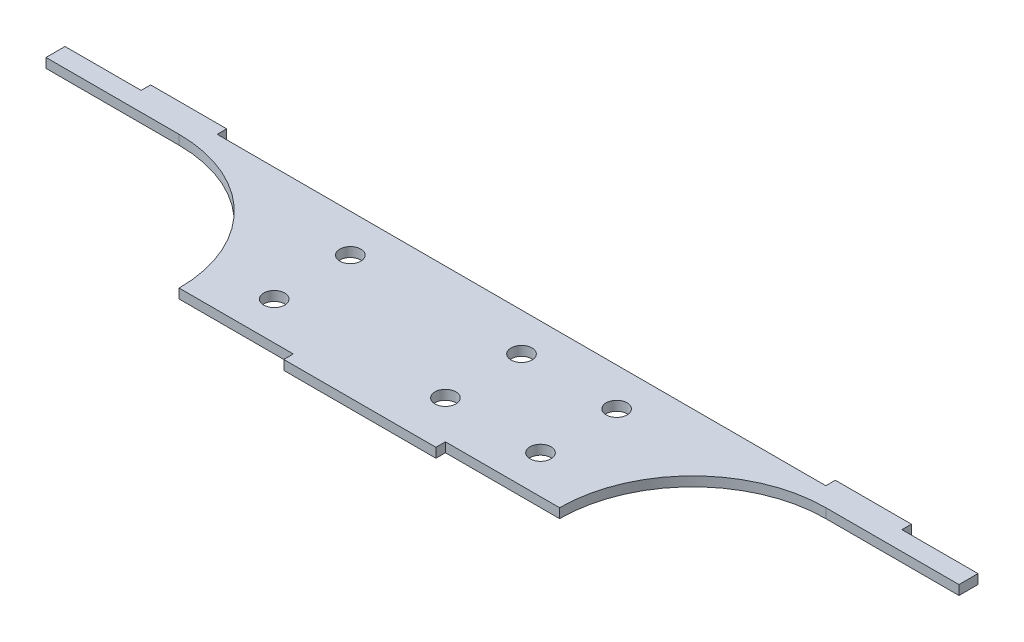
from build123d import *

# Parameters (mm, degrees)
SKETCH1_R           = 3.5
BOSS_EXTRUDE1_DEPTH = 3.175


with BuildPart() as part:
    # Sketch1 → Boss-Extrude1 (new body)
    with BuildSketch(Plane(origin=(0, 0, 0), x_dir=(1, 0, 0), z_dir=(0, 1, 0))):
        with BuildLine():
            Line((-152.4, 19.05), (-107.95, 19.05))
            ThreePointArc((-107.95, 19.05), (-76.519103576, 6.030896424), (-63.5, -25.4))
            Line((-63.5, -25.4), (-25.4, -25.4))
            Line((-25.4, -25.4), (-25.4, -28.575))
            Line((-25.4, -28.575), (25.4, -28.575))
            Line((25.4, -28.575), (25.4, -25.4))
            Line((25.4, -25.4), (63.5, -25.4))
            ThreePointArc((63.5, -25.4), (76.519103576, 6.030896424), (107.95, 19.05))
            Line((107.95, 19.05), (152.4, 19.05))
            Line((152.4, 19.05), (152.4, 25.4))
            Line((152.4, 25.4), (127, 25.4))
            Line((127, 25.4), (127, 28.575))
            Line((127, 28.575), (101.6, 28.575))
            Line((101.6, 28.575), (101.6, 25.4))
            Line((101.6, 25.4), (-101.6, 25.4))
            Line((-101.6, 25.4), (-101.6, 28.575))
            Line((-101.6, 28.575), (-127, 28.575))
            Line((-127, 28.575), (-127, 25.4))
            Line((-127, 25.4), (-152.4, 25.4))
            Line((-152.4, 25.4), (-152.4, 19.05))
        make_face()
        with Locations((-44.45, -12.7)):
            Circle(SKETCH1_R, mode=Mode.SUBTRACT)
        with Locations((12.7, -12.7)):
            Circle(SKETCH1_R, mode=Mode.SUBTRACT)
        with Locations((44.45, -12.7)):
            Circle(SKETCH1_R, mode=Mode.SUBTRACT)
        with Locations((-44.45, 12.7)):
            Circle(SKETCH1_R, mode=Mode.SUBTRACT)
        with Locations((12.7, 12.7)):
            Circle(SKETCH1_R, mode=Mode.SUBTRACT)
        with Locations((44.45, 12.7)):
            Circle(SKETCH1_R, mode=Mode.SUBTRACT)
    extrude(amount=BOSS_EXTRUDE1_DEPTH)


solid = part.part
